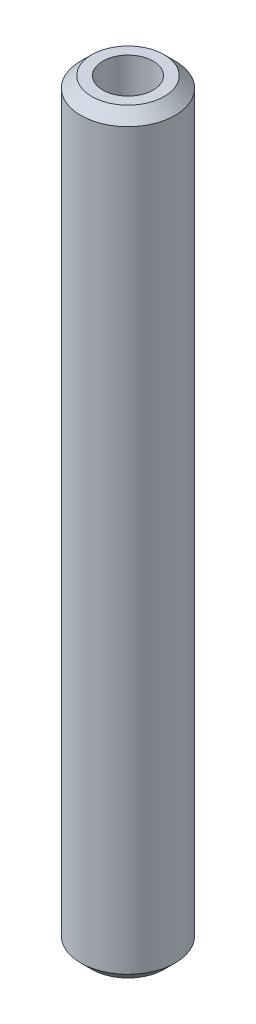
from build123d import *

# Parameters (mm, degrees)
SKETCH1_R           = 5
BOSS_EXTRUDE1_DEPTH = 80.134354402
SKETCH2_R           = 2.664974928
CUT_EXTRUDE1_DEPTH  = 81.445725526
CHAMFER1_SIZE       = 1.158739023


with BuildPart() as part:
    # Sketch1 → Boss-Extrude1 (new body)
    with BuildSketch(Plane(origin=(0, 0, 0), x_dir=(1, 0, 0), z_dir=(0, 1, 0))):
        Circle(SKETCH1_R)
    extrude(amount=BOSS_EXTRUDE1_DEPTH)

    # Sketch2 → Cut-Extrude1 (cut, through all)
    with BuildSketch(Plane(origin=(0, 0, 0), x_dir=(1, 0, 0), z_dir=(0, 1, 0))):
        Circle(SKETCH2_R)
    extrude(amount=CUT_EXTRUDE1_DEPTH, mode=Mode.SUBTRACT)

    # Chamfer1
    chamfer1_edges = [part.edges().sort_by_distance(p)[0] for p in [
        (-5, 80.134354402, 0),
        (-5, 0, 0),
    ]]
    chamfer(chamfer1_edges, length=CHAMFER1_SIZE)


solid = part.part
